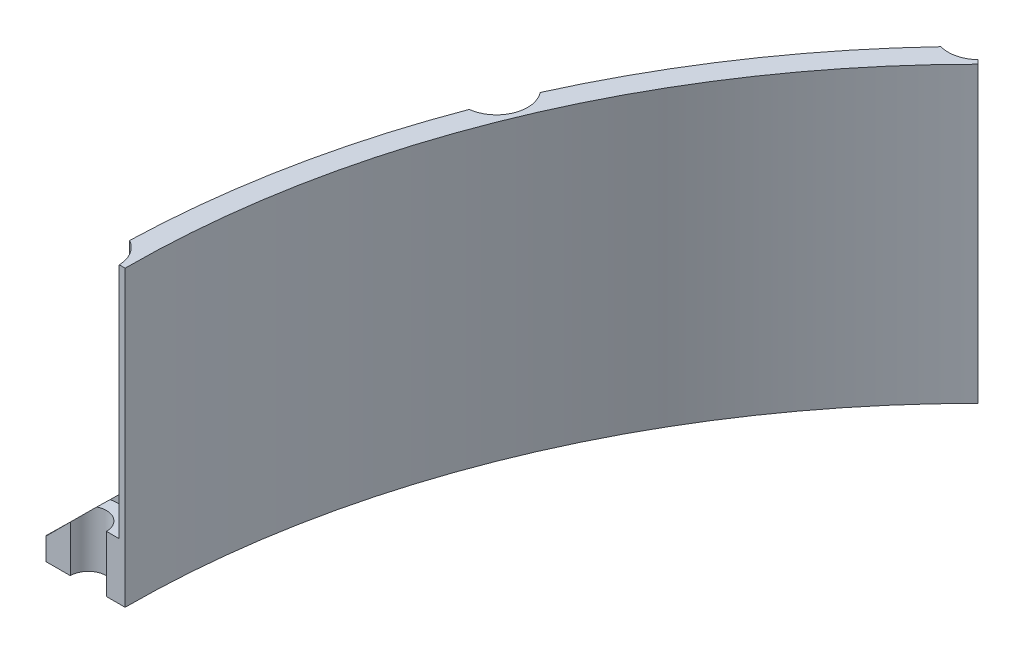
from build123d import *

# Parameters (mm, degrees)
SKETCH1_R           = 1.6
SKETCH1_R_2         = 1.25
BOSS_EXTRUDE1_DEPTH = 2
BOSS_EXTRUDE3_DEPTH = 24
CHAMFER2_SIZE       = 5
SKETCH3_R           = 2.75
CUT_EXTRUDE1_DEPTH  = 21


with BuildPart() as part:
    # Sketch1 → Boss-Extrude1 (new body)
    with BuildSketch(Plane(origin=(0, 0, 0), x_dir=(1, 0, 0), z_dir=(0, 1, 0))):
        with BuildLine():
            Line((-53.38656198, 53.38656198), (-54.553288169, 54.553288169))
            ThreePointArc((-54.553288169, 54.553288169), (-56.816029868, 54.553288169), (-56.816029868, 56.816029868))
            Line((-56.816029868, 56.816029868), (-58.336309448, 58.336309448))
            ThreePointArc((-58.336309448, 58.336309448), (-76.220061432, 31.57138317), (-82.5, 0))
            Line((-82.5, 0), (-80.35, 0))
            ThreePointArc((-80.35, 0), (-78.75, 1.6), (-77.15, 0))
            Line((-77.15, 0), (-75.5, 0))
            ThreePointArc((-75.5, 0), (-69.752904705, 28.892599144), (-53.38656198, 53.38656198))
        make_face()
        with Locations(Location((-72.755513185, 30.136320299, 0), (0, 0, 270))):
            Circle(SKETCH1_R, mode=Mode.SUBTRACT)
        with Locations(Location((-77.236840832, 15.363362859, 0), (0, 0, 270))):
            Circle(SKETCH1_R_2, mode=Mode.SUBTRACT)
        with Locations(Location((-65.478231969, 43.75115585, 0), (0, 0, 270))):
            Circle(SKETCH1_R_2, mode=Mode.SUBTRACT)
    extrude(amount=BOSS_EXTRUDE1_DEPTH)

    # Sketch2 → Boss-Extrude3 (add)
    with BuildSketch(Plane(origin=(0, 2, 0), x_dir=(1, 0, 0), z_dir=(0, 1, 0))):
        with BuildLine():
            Line((-75.5, 0), (-77.15, 0))
            ThreePointArc((-77.15, 0), (-77.22797812, 0.493405915), (-77.454311746, 0.938718248))
            ThreePointArc((-77.454311746, 0.938718248), (-77.086470316, 7.562898661), (-76.153142939, 14.131305885))
            ThreePointArc((-76.153142939, 14.131305885), (-74.455316583, 21.326592742), (-72.07927757, 28.327250276))
            ThreePointArc((-72.07927757, 28.327250276), (-71.988492028, 28.556854202), (-71.896975095, 28.786167586))
            ThreePointArc((-71.896975095, 28.786167586), (-71.277594826, 29.523329822), (-71.193405789, 30.482471253))
            ThreePointArc((-71.193405789, 30.482471253), (-68.314800527, 36.47311401), (-64.933244978, 42.194936357))
            ThreePointArc((-64.933244978, 42.194936357), (-60.45388582, 48.389737192), (-55.385713525, 54.112834731))
            ThreePointArc((-55.385713525, 54.112834731), (-54.936360269, 54.270428139), (-54.553288169, 54.553288169))
            Line((-54.553288169, 54.553288169), (-53.38656198, 53.38656198))
            ThreePointArc((-53.38656198, 53.38656198), (-69.752904705, 28.892599144), (-75.5, 0))
        make_face()
    extrude(amount=BOSS_EXTRUDE3_DEPTH)

    # Chamfer2
    # the kernel refuses this chamfer: 5 mm, written as the material it adds along each edge
    with BuildSketch(Plane(origin=(-0.000495077, 2, 0.039996936), x_dir=(-0.5896650558318113, 0, -0.8076478947727573), z_dir=(0.8076478947727573, 0, -0.5896650558318113))) as chamfer2_piece_1_section:
        Polygon((77.46 + CHAMFER2_SIZE, 0), (77.46, CHAMFER2_SIZE), (77.46, 0), align=None)
    chamfer2_piece_1 = revolve(axis=Axis((-0.000495077, 2, 0.039996936), (0, 1, 0)), revolution_arc=40.171888597, mode=Mode.PRIVATE)
    chamfer2_piece_1 = chamfer2_piece_1 - Plane(origin=(-65.478231969, 3.629075294, -43.75115585), x_dir=(0, 0, 1), z_dir=(0, -1, 0)) * Cylinder(1.25, 330, mode=Mode.PRIVATE)
    chamfer2_piece_1 = chamfer2_piece_1 - Plane(origin=(-72.755513185, 3.629075294, -30.136320299), x_dir=(0, 0, 1), z_dir=(0, -1, 0)) * Cylinder(1.6, 330, mode=Mode.PRIVATE)
    chamfer2_piece_1 = split(chamfer2_piece_1, bisect_by=Plane(origin=(-53.187185599, 3.629075294, -53.187185599), z_dir=(-0.7071067811865476, 0, 0.7071067811865476)), keep=Keep.TOP, mode=Mode.PRIVATE)
    chamfer2_piece_1 = chamfer2_piece_1 - Plane(origin=(-55.684659018, 3.629075294, -55.684659018), x_dir=(0.7071067811865365, 0, 0.7071067811865587), z_dir=(0, -1, 0)) * Cylinder(1.6, 330, mode=Mode.PRIVATE)
    add(chamfer2_piece_1)
    with BuildSketch(Plane(origin=(-0.000495079, 2, 0.039996936), x_dir=(-0.8539218863713415, 0, -0.52040120289639), z_dir=(0.52040120289639, 0, -0.8539218863713415))) as chamfer2_piece_2_section:
        Polygon((77.459999998 + CHAMFER2_SIZE, 0), (77.459999998, CHAMFER2_SIZE), (77.459999998, 0), align=None)
    chamfer2_piece_2 = revolve(axis=Axis((-0.000495079, 2, 0.039996936), (0, 1, 0)), revolution_arc=40.146560284, mode=Mode.PRIVATE)
    chamfer2_piece_2 = chamfer2_piece_2 - Plane(origin=(-77.236840832, 3.628431505, -15.363362859), x_dir=(0, 0, 1), z_dir=(0, -1, 0)) * Cylinder(1.25, 330, mode=Mode.PRIVATE)
    chamfer2_piece_2 = chamfer2_piece_2 - Plane(origin=(-72.755513185, 3.628431505, -30.136320299), x_dir=(0, 0, 1), z_dir=(0, -1, 0)) * Cylinder(1.6, 330, mode=Mode.PRIVATE)
    chamfer2_piece_2 = chamfer2_piece_2 - Plane(origin=(-78.75, 3.628431505, 0), x_dir=(-1, 0, 0), z_dir=(0, -1, 0)) * Cylinder(1.6, 330, mode=Mode.PRIVATE)
    chamfer2_piece_2 = split(chamfer2_piece_2, bisect_by=Plane(origin=(-75.22737359, 3.628431505, 0), z_dir=(0, 0, -1)), keep=Keep.TOP, mode=Mode.PRIVATE)
    add(chamfer2_piece_2)

    # Sketch3 → Cut-Extrude1 (cut)
    with BuildSketch(Plane(origin=(0, 26, 0), x_dir=(1, 0, 0), z_dir=(0, 1, 0))):
        with Locations((-72.755513185, 30.136320299)):
            Circle(SKETCH3_R)
        with Locations((-78.76534385, -0.077138745)):
            Circle(SKETCH3_R)
        with Locations((-55.616814575, 55.733901863)):
            Circle(SKETCH3_R)
    extrude(amount=-CUT_EXTRUDE1_DEPTH, mode=Mode.SUBTRACT)


solid = part.part
